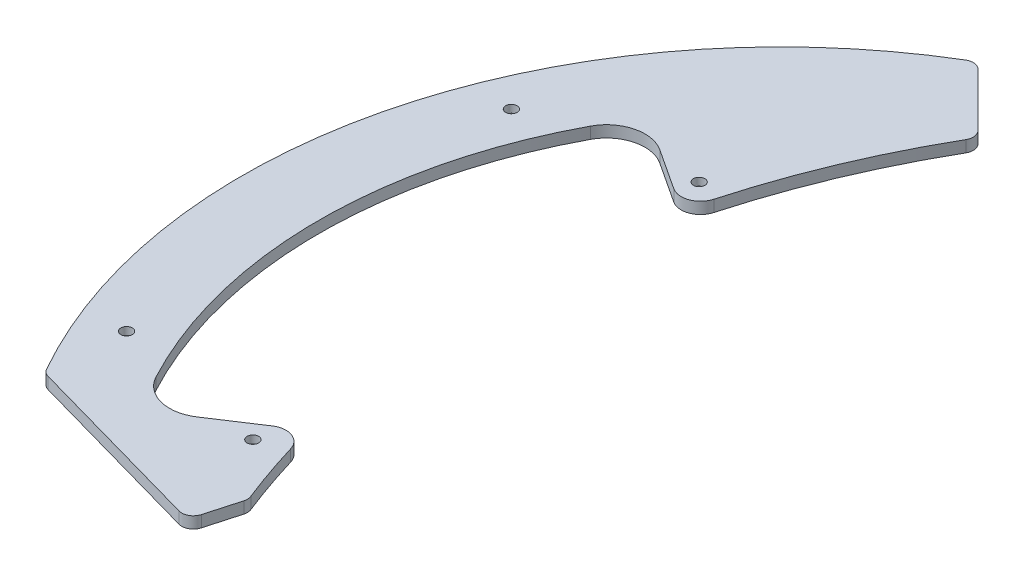
from build123d import *

# Parameters (mm, degrees)
SKETCH1_R               = 140
BOSS_EXTRUDE1_DEPTH     = 3
CUT_EXTRUDE1_REACH      = 200.013
CUT_EXTRUDE3_REACH      = 200.013
SKETCH19_R              = 1.5
CUT_EXTRUDE4_REACH      = 200.013
FILLET2_R               = 10
CUT_EXTRUDE8_DEPTH      = 186.226887897
CUT_EXTRUDE8_DEPTH_BACK = 186.226887897
CUT_EXTRUDE9_REACH      = 187.227
FILLET4_R               = 5
FILLET6_R               = 10
CUT_EXTRUDE10_REACH     = 187.227
SKETCH25_R              = 1.5
FILLET5_R               = 3
SKETCH26_R              = 3
CUT_EXTRUDE11_DEPTH     = 1


with BuildPart() as part:
    # Sketch1 → Boss-Extrude1 (new body)
    with BuildSketch(Plane(origin=(0, 0, 0), x_dir=(1, 0, 0), z_dir=(0, 1, 0))):
        Circle(SKETCH1_R)
    extrude(amount=BOSS_EXTRUDE1_DEPTH)

    # Sketch17 → Cut-Extrude1 (cut, up to next)
    with BuildSketch(Plane.XZ, mode=Mode.PRIVATE) as cut_extrude1_sk1:
        Polygon((-50, 90), (-121.24355653, 70), (-121.24355653, 140), (121.24355653, 140), (121.24355653, 70), (50, 90), align=None)
    cut_extrude1_tool1 = extrude(cut_extrude1_sk1.sketch, amount=-CUT_EXTRUDE1_REACH, mode=Mode.PRIVATE) & part.part
    add(cut_extrude1_tool1.solids().sort_by_distance((0, 0, 111.669853))[0], mode=Mode.SUBTRACT)

    # Sketch19 → Cut-Extrude3 (cut, up to next)
    with BuildSketch(Plane(origin=(0, 3, 0), x_dir=(1, 0, 0), z_dir=(0, 1, 0)), mode=Mode.PRIVATE) as cut_extrude3_sk1:
        with Locations((-79.195959493, -57.982756057)):
            Circle(SKETCH19_R)
    cut_extrude3_tool1 = extrude(cut_extrude3_sk1.sketch, amount=-CUT_EXTRUDE3_REACH, mode=Mode.PRIVATE) & part.part
    # Sketch19 → Cut-Extrude3 (cut, up to next)
    with BuildSketch(Plane(origin=(0, 3, 0), x_dir=(1, 0, 0), z_dir=(0, 1, 0)), mode=Mode.PRIVATE) as cut_extrude3_sk2:
        with Locations((-79.195959493, 57.982756057)):
            Circle(SKETCH19_R)
    cut_extrude3_tool2 = extrude(cut_extrude3_sk2.sketch, amount=-CUT_EXTRUDE3_REACH, mode=Mode.PRIVATE) & part.part
    # Sketch19 → Cut-Extrude3 (cut, up to next)
    with BuildSketch(Plane(origin=(0, 3, 0), x_dir=(1, 0, 0), z_dir=(0, 1, 0)), mode=Mode.PRIVATE) as cut_extrude3_sk3:
        with Locations((79.195959493, 57.982756057)):
            Circle(SKETCH19_R)
    cut_extrude3_tool3 = extrude(cut_extrude3_sk3.sketch, amount=-CUT_EXTRUDE3_REACH, mode=Mode.PRIVATE) & part.part
    # Sketch19 → Cut-Extrude3 (cut, up to next)
    with BuildSketch(Plane(origin=(0, 3, 0), x_dir=(1, 0, 0), z_dir=(0, 1, 0)), mode=Mode.PRIVATE) as cut_extrude3_sk4:
        with Locations((79.195959493, -57.982756057)):
            Circle(SKETCH19_R)
    cut_extrude3_tool4 = extrude(cut_extrude3_sk4.sketch, amount=-CUT_EXTRUDE3_REACH, mode=Mode.PRIVATE) & part.part
    # Sketch19 → Cut-Extrude3 (cut, up to next)
    with BuildSketch(Plane(origin=(0, 3, 0), x_dir=(1, 0, 0), z_dir=(0, 1, 0)), mode=Mode.PRIVATE) as cut_extrude3_sk5:
        with Locations((-57.982756057, 79.195959493)):
            Circle(SKETCH19_R)
    cut_extrude3_tool5 = extrude(cut_extrude3_sk5.sketch, amount=-CUT_EXTRUDE3_REACH, mode=Mode.PRIVATE) & part.part
    # Sketch19 → Cut-Extrude3 (cut, up to next)
    with BuildSketch(Plane(origin=(0, 3, 0), x_dir=(1, 0, 0), z_dir=(0, 1, 0)), mode=Mode.PRIVATE) as cut_extrude3_sk6:
        with Locations((57.982756057, 79.195959493)):
            Circle(SKETCH19_R)
    cut_extrude3_tool6 = extrude(cut_extrude3_sk6.sketch, amount=-CUT_EXTRUDE3_REACH, mode=Mode.PRIVATE) & part.part
    # Sketch19 → Cut-Extrude3 (cut, up to next)
    with BuildSketch(Plane(origin=(0, 3, 0), x_dir=(1, 0, 0), z_dir=(0, 1, 0)), mode=Mode.PRIVATE) as cut_extrude3_sk7:
        with Locations((57.982756057, -79.195959493)):
            Circle(SKETCH19_R)
    cut_extrude3_tool7 = extrude(cut_extrude3_sk7.sketch, amount=-CUT_EXTRUDE3_REACH, mode=Mode.PRIVATE) & part.part
    # Sketch19 → Cut-Extrude3 (cut, up to next)
    with BuildSketch(Plane(origin=(0, 3, 0), x_dir=(1, 0, 0), z_dir=(0, 1, 0)), mode=Mode.PRIVATE) as cut_extrude3_sk8:
        with Locations((-57.982756057, -79.195959493)):
            Circle(SKETCH19_R)
    cut_extrude3_tool8 = extrude(cut_extrude3_sk8.sketch, amount=-CUT_EXTRUDE3_REACH, mode=Mode.PRIVATE) & part.part
    add(cut_extrude3_tool1.solids().sort_by_distance((-79.195959, 3, 57.982756))[0], mode=Mode.SUBTRACT)
    add(cut_extrude3_tool2.solids().sort_by_distance((-79.195959, 3, -57.982756))[0], mode=Mode.SUBTRACT)
    add(cut_extrude3_tool3.solids().sort_by_distance((79.195959, 3, -57.982756))[0], mode=Mode.SUBTRACT)
    add(cut_extrude3_tool4.solids().sort_by_distance((79.195959, 3, 57.982756))[0], mode=Mode.SUBTRACT)
    add(cut_extrude3_tool5.solids().sort_by_distance((-57.982756, 3, -79.195959))[0], mode=Mode.SUBTRACT)
    add(cut_extrude3_tool6.solids().sort_by_distance((57.982756, 3, -79.195959))[0], mode=Mode.SUBTRACT)
    add(cut_extrude3_tool7.solids().sort_by_distance((57.982756, 3, 79.195959))[0], mode=Mode.SUBTRACT)
    add(cut_extrude3_tool8.solids().sort_by_distance((-57.982756, 3, 79.195959))[0], mode=Mode.SUBTRACT)

    # Sketch20 → Cut-Extrude4 (cut, up to next)
    with BuildSketch(Plane(origin=(0, 3, 0), x_dir=(1, 0, 0), z_dir=(0, 1, 0)), mode=Mode.PRIVATE) as cut_extrude4_sk1:
        Polygon((-498.316459894, 549.560016424), (-70, 121.24355653), (-50, 101.24355653), (50, 101.24355653), (70, 121.24355653), (498.316459894, 549.560016424), (498.316459894, 1761.021909565), (-498.316459894, 1761.021909565), align=None)
    cut_extrude4_tool1 = extrude(cut_extrude4_sk1.sketch, amount=-CUT_EXTRUDE4_REACH, mode=Mode.PRIVATE) & part.part
    add(cut_extrude4_tool1.solids().sort_by_distance((0, 3, -1025.243605))[0], mode=Mode.SUBTRACT)

    # Fillet2
    fillet2_edges = [part.edges().sort_by_distance(p)[0] for p in [
        (50, 1.5, -101.24355653),
        (-50, 1.5, -101.24355653),
    ]]
    fillet(fillet2_edges, radius=FILLET2_R)

    # Sketch23 → Cut-Extrude8 (cut, two sides: drawn at the far end of the back side and taken through both)
    with BuildSketch(Plane(origin=(0, 3, 0), x_dir=(1, 0, 0), z_dir=(0, 1, 0)).offset(-CUT_EXTRUDE8_DEPTH_BACK)):
        with BuildLine():
            Line((261.924008605, 637.436261059), (-52.928932188, 104.172488718))
            ThreePointArc((-52.928932188, 104.172488718), (-80.130232259, 17.669229552), (-66.336519501, -71.95475195))
            Line((-66.336519501, -71.95475195), (-73.189737717, -96.367133919))
            Line((-73.189737717, -96.367133919), (-240.56703475, -692.594830068))
            Line((-240.56703475, -692.594830068), (918.053550165, -1130.326301498))
            Line((918.053550165, -1130.326301498), (1420.54459352, 199.704789628))
            Line((1420.54459352, 199.704789628), (261.924008605, 637.436261059))
        make_face()
    extrude(amount=CUT_EXTRUDE8_DEPTH + CUT_EXTRUDE8_DEPTH_BACK, mode=Mode.SUBTRACT)

    # Sketch24 → Cut-Extrude9 (cut, up to next)
    with BuildSketch(Plane(origin=(0, 3, 0), x_dir=(1, 0, 0), z_dir=(0, 1, 0)), mode=Mode.PRIVATE) as cut_extrude9_sk1:
        with BuildLine():
            Line((0, 0), (-100.308962252, 65.864346136))
            ThreePointArc((-100.308962252, 65.864346136), (-120, 0), (-100.308962252, -65.864346136))
            Line((-100.308962252, -65.864346136), (0, 0))
        make_face()
    cut_extrude9_tool1 = extrude(cut_extrude9_sk1.sketch, amount=-CUT_EXTRUDE9_REACH, mode=Mode.PRIVATE) & part.part
    add(cut_extrude9_tool1.solids().sort_by_distance((-75.574375, 3, 0))[0], mode=Mode.SUBTRACT)

    # Fillet4
    fillet4_edges = [part.edges().sort_by_distance(p)[0] for p in [
        (-74.063830686, 1.5, 48.63140512),
        (-75.142204111, 1.5, -49.339481038),
    ]]
    fillet(fillet4_edges, radius=FILLET4_R)

    # Fillet6
    fillet6_edges = [part.edges().sort_by_distance(p)[0] for p in [
        (-100.308962252, 1.5, -65.864346136),
        (-100.308962252, 1.5, 65.864346136),
    ]]
    fillet(fillet6_edges, radius=FILLET6_R)

    # Sketch25 → Cut-Extrude10 (cut, up to next)
    with BuildSketch(Plane(origin=(0, 3, 0), x_dir=(1, 0, 0), z_dir=(0, 1, 0)), mode=Mode.PRIVATE) as cut_extrude10_sk1:
        with Locations((-120, 50)):
            Circle(SKETCH25_R)
    cut_extrude10_tool1 = extrude(cut_extrude10_sk1.sketch, amount=-CUT_EXTRUDE10_REACH, mode=Mode.PRIVATE) & part.part
    # Sketch25 → Cut-Extrude10 (cut, up to next)
    with BuildSketch(Plane(origin=(0, 3, 0), x_dir=(1, 0, 0), z_dir=(0, 1, 0)), mode=Mode.PRIVATE) as cut_extrude10_sk2:
        with Locations((-120, -50)):
            Circle(SKETCH25_R)
    cut_extrude10_tool2 = extrude(cut_extrude10_sk2.sketch, amount=-CUT_EXTRUDE10_REACH, mode=Mode.PRIVATE) & part.part
    add(cut_extrude10_tool1.solids().sort_by_distance((-120, 3, -50))[0], mode=Mode.SUBTRACT)
    add(cut_extrude10_tool2.solids().sort_by_distance((-120, 3, 50))[0], mode=Mode.SUBTRACT)

    # Fillet5
    fillet5_edges = [part.edges().sort_by_distance(p)[0] for p in [
        (-70, 1.5, -121.24355653),
        (-66.336519501, 1.5, 71.95475195),
        (-69.838855295, 1.5, 84.430694855),
        (-121.24355653, 1.5, 70),
        (-52.928932188, 1.5, -104.172488718),
    ]]
    fillet(fillet5_edges, radius=FILLET5_R)

    # Sketch26 → Cut-Extrude11 (cut)
    with BuildSketch(Plane.XZ):
        with Locations((-79.195959493, 57.982756057)):
            Circle(SKETCH26_R)
        with Locations((-120, 50)):
            Circle(SKETCH26_R)
        with Locations((-120, -50)):
            Circle(SKETCH26_R)
        with Locations((-79.195959493, -57.982756057)):
            Circle(SKETCH26_R)
    extrude(amount=-CUT_EXTRUDE11_DEPTH, mode=Mode.SUBTRACT)


solid = part.part
